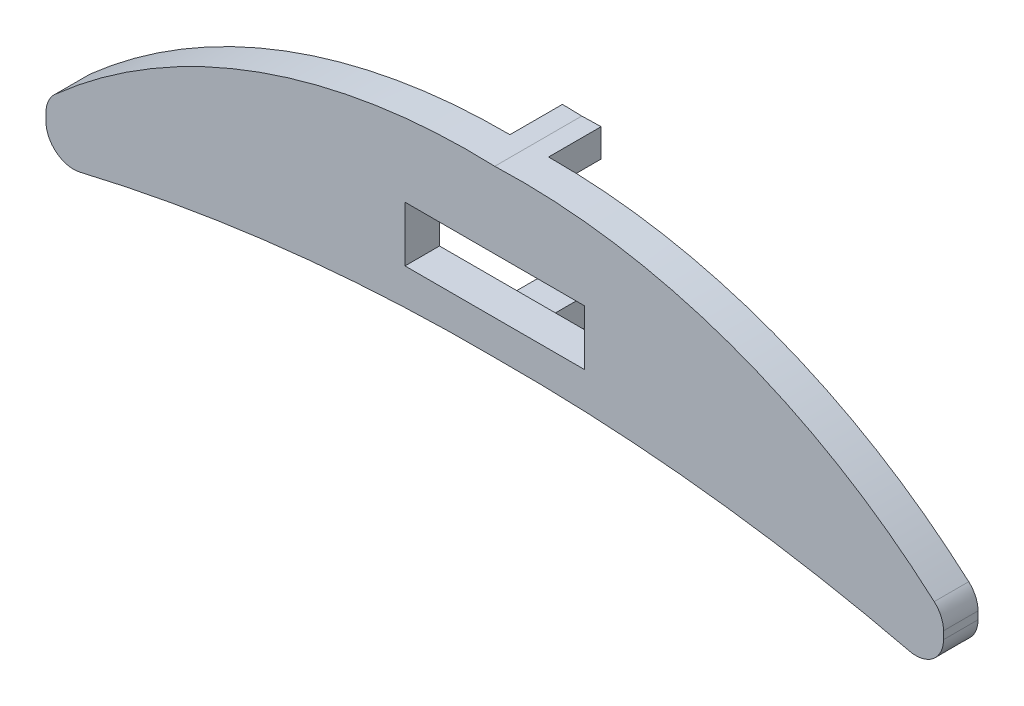
from build123d import *

# Parameters (mm, degrees)
BOSS_EXTRUDE1_DEPTH = 2.5
SKETCH2_W           = 13
SKETCH2_H           = 4
CUT_EXTRUDE3_DEPTH  = 2.5
BOSS_EXTRUDE2_START = 3.8
BOSS_EXTRUDE2_DEPTH = 3.8
VARFILLET1_R        = 2


with BuildPart() as part:
    # Sketch1 → Boss-Extrude1 (new body)
    with BuildSketch(Plane.XY):
        with BuildLine():
            Line((0, -4), (0, 0))
            ThreePointArc((0, 0), (-15.056525796, 9.23232597), (-32.5, 12))
            ThreePointArc((-32.5, 12), (-49.943474204, 9.23232597), (-65, 0))
            Line((-65, 0), (-65, -4))
            ThreePointArc((-65, -4), (-48.881086926, -0.934918729), (-32.5, 0))
            ThreePointArc((-32.5, 0), (-16.118913074, -0.934918729), (0, -4))
        make_face()
    extrude(amount=BOSS_EXTRUDE1_DEPTH)

    # Sketch2 → Cut-Extrude3 (cut)
    with BuildSketch(Plane.XY.offset(2.5)):
        with Locations((-32.5, 4.5)):
            Rectangle(SKETCH2_W, SKETCH2_H)
    extrude(amount=-CUT_EXTRUDE3_DEPTH, mode=Mode.SUBTRACT)

    # Sketch3 → Boss-Extrude2 (add)
    with BuildSketch(Plane(origin=(0, 0, 0), x_dir=(-1, 0, 0), z_dir=(0, 0, -1)).offset(BOSS_EXTRUDE2_START)):
        with BuildLine():
            ThreePointArc((33.9, 12.032943433), (33.199872595, 12.021886063), (32.5, 12))
            ThreePointArc((32.5, 12), (31.800127405, 12.021886063), (31.1, 12.032943433))
            Line((31.1, 12.032943433), (31.1, 10))
            Line((31.1, 10), (33.9, 10))
            Line((33.9, 10), (33.9, 12.032943433))
        make_face()
        with BuildLine():
            ThreePointArc((31.1, 0.015701129), (31.800023358, 0.009933302), (32.5, 0))
            ThreePointArc((32.5, 0), (33.199976642, 0.009933302), (33.9, 0.015701129))
            Line((33.9, 0.015701129), (33.9, 2.005619302))
            Line((33.9, 2.005619302), (31.1, 2.005619302))
            Line((31.1, 2.005619302), (31.1, 0.015701129))
        make_face()
    extrude(amount=-BOSS_EXTRUDE2_DEPTH)

    # VarFillet1
    varfillet1_edges = [part.edges().sort_by_distance(p)[0] for p in [
        (0, -4, 1.25),
        (0, 0, 1.25),
        (-65, -4, 1.25),
        (-65, 0, 1.25),
    ]]
    fillet(varfillet1_edges, radius=VARFILLET1_R)


solid = part.part
